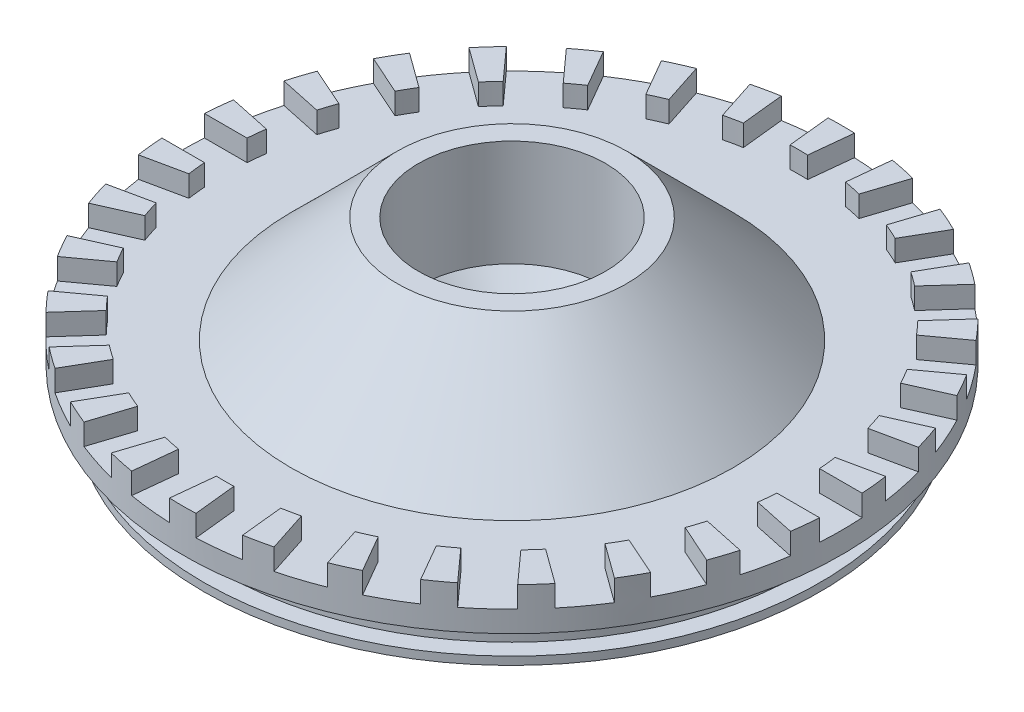
from build123d import *

# Parameters (mm, degrees)
SKETCH2_W          = 12.7
SKETCH2_H          = 6.35
CUT_EXTRUDE1_DEPTH = 3.175
CIRPATTERN1_COUNT  = 30


with BuildPart() as part:
    # Sketch1 → Revolve1 (revolve)
    with BuildSketch(Plane.XY):
        Polygon((-7.62, 0), (-46.0375, 0), (-46.0375, 1.2065), (-43.4975, 1.2065), (-43.4975, 4.7625), (-46.0375, 4.7625), (-46.0375, 6.35), (-49.2125, 6.35), (-49.2125, 12.7), (-42.8625, 12.7), (-42.8625, 9.525), (-33.02, 9.525), (-17.145, 25.4), (-13.97, 25.4), (-13.97, 9.525), (-7.62, 3.175), align=None)
    revolve(axis=Axis((0, -42.3, 0), (0, 1, 0)))

    # Sketch2 → Cut-Extrude1 (cut)
    with BuildSketch(Plane(origin=(0, 12.7, 0), x_dir=(1, 0, 0), z_dir=(0, 1, 0))):
        with Locations((49.094745657, 0)):
            Rectangle(SKETCH2_W, SKETCH2_H)
    cut_extrude1 = extrude(amount=-CUT_EXTRUDE1_DEPTH, mode=Mode.SUBTRACT)

    # CirPattern1: Cut-Extrude1 ×30 about axis
    cirpattern1_axis = Axis((0, -42.3, 0), (0, -1, 0))
    for i in range(1, CIRPATTERN1_COUNT):
        add(cut_extrude1.rotate(cirpattern1_axis, i * 360 / CIRPATTERN1_COUNT), mode=Mode.SUBTRACT)


solid = part.part
